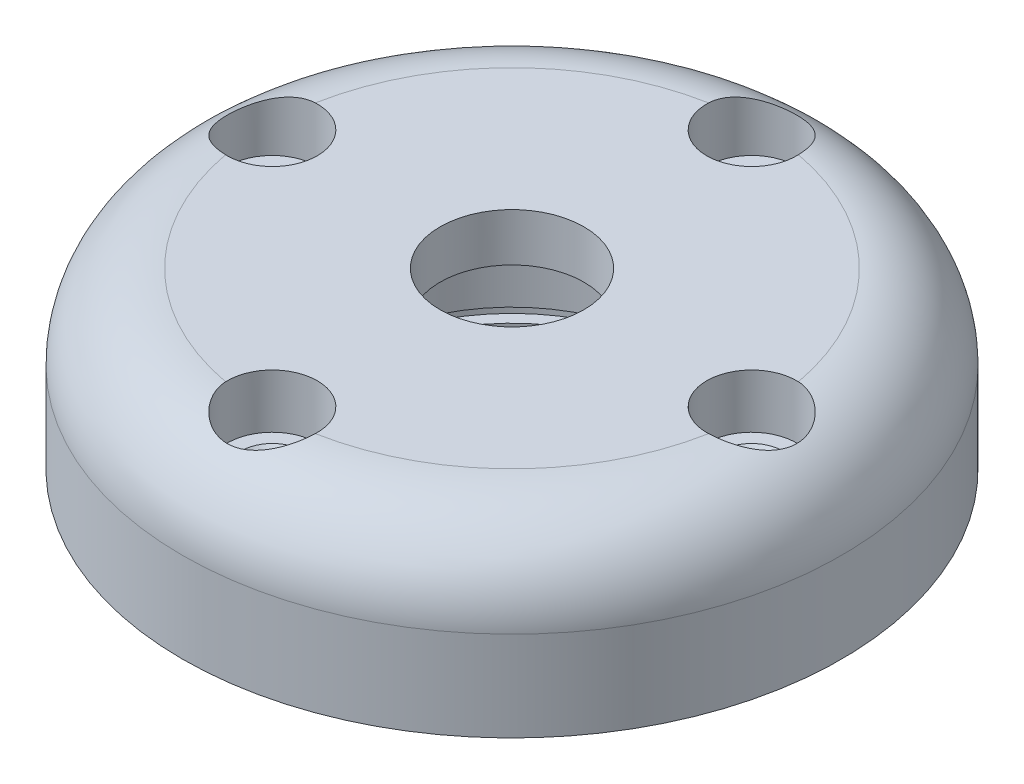
from build123d import *

# Parameters (mm, degrees)
BOSS_EXTRUDE1_START       = 3
SKETCH1_R                 = 27.5
SKETCH1_R_2               = 14
BOSS_EXTRUDE1_DEPTH       = 18
BOSS_EXTRUDE2_START       = 18
SKETCH1_3_R               = 14
BOSS_EXTRUDE2_DEPTH       = 3
BOSS_EXTRUDE3_START       = 9
SKETCH1_4_R               = 14
SKETCH1_4_R_2             = 13
BOSS_EXTRUDE3_DEPTH       = 9
CUT_EXTRUDE1_REACH        = 44.854
SKETCH2_R                 = 2.1
SKETCH2_3_R               = 3.75
SKETCH2_3_R_2             = 2.1
CUT_EXTRUDE2_DEPTH        = 4.5
CHAMFER1_SIZE             = 0.5
BOSS_EXTRUDE4_START       = 3
BOSS_EXTRUDE4_OUTLINE_R   = 14
BOSS_EXTRUDE4_OUTLINE_R_2 = 13
BOSS_EXTRUDE4_DEPTH       = 4.84
BOSS_EXTRUDE5_START       = 1
SKETCH3_R                 = 13
BOSS_EXTRUDE5_DEPTH       = 1
SKETCH4_R                 = 35
CUT_EXTRUDE3_DEPTH        = 3.5
CUT_EXTRUDE5_REACH        = 42.283
SKETCH5_R                 = 6
FILLET1_R                 = 7


# Read off the part's stored shape, not the designer's step: Boss-Extrude4
with BuildPart() as part:
    # Sketch1 → Boss-Extrude1 (new body)
    with BuildSketch(Plane(origin=(0, 0, 0), x_dir=(1, 0, 0), z_dir=(0, 1, 0)).offset(BOSS_EXTRUDE1_START)):
        with Locations(Location((0, 0, 0), (0, 0, 270))):
            Circle(SKETCH1_R)
        with Locations(Location((0, 0, 0), (0, 0, 270))):
            Circle(SKETCH1_R_2, mode=Mode.SUBTRACT)
    extrude(amount=BOSS_EXTRUDE1_DEPTH)

    # Sketch1<3> → Boss-Extrude2 (add)
    with BuildSketch(Plane(origin=(0, 0, 0), x_dir=(1, 0, 0), z_dir=(0, 1, 0)).offset(BOSS_EXTRUDE2_START)):
        with Locations(Location((0, 0, 0), (0, 0, 270))):
            Circle(SKETCH1_3_R)
    extrude(amount=BOSS_EXTRUDE2_DEPTH)

    # Sketch1<4> → Boss-Extrude3 (add)
    with BuildSketch(Plane(origin=(0, 0, 0), x_dir=(1, 0, 0), z_dir=(0, 1, 0)).offset(BOSS_EXTRUDE3_START)):
        with Locations(Location((0, 0, 0), (0, 0, 270))):
            Circle(SKETCH1_4_R)
        with Locations(Location((0, 0, 0), (0, 0, 270))):
            Circle(SKETCH1_4_R_2, mode=Mode.SUBTRACT)
    extrude(amount=BOSS_EXTRUDE3_DEPTH)

    # Sketch2 → Cut-Extrude1 (cut, up to next)
    with BuildSketch(Plane(origin=(0, 21, 0), x_dir=(1, 0, 0), z_dir=(0, 1, 0)), mode=Mode.PRIVATE) as cut_extrude1_sk1:
        with Locations(Location((0, -20, 0), (0, 0, 270))):
            Circle(SKETCH2_R)
    cut_extrude1_tool1 = extrude(cut_extrude1_sk1.sketch, amount=-CUT_EXTRUDE1_REACH, mode=Mode.PRIVATE) & part.part
    # Sketch2 → Cut-Extrude1 (cut, up to next)
    with BuildSketch(Plane(origin=(0, 21, 0), x_dir=(1, 0, 0), z_dir=(0, 1, 0)), mode=Mode.PRIVATE) as cut_extrude1_sk2:
        with Locations(Location((-20, 0, 0), (0, 0, 270))):
            Circle(SKETCH2_R)
    cut_extrude1_tool2 = extrude(cut_extrude1_sk2.sketch, amount=-CUT_EXTRUDE1_REACH, mode=Mode.PRIVATE) & part.part
    # Sketch2 → Cut-Extrude1 (cut, up to next)
    with BuildSketch(Plane(origin=(0, 21, 0), x_dir=(1, 0, 0), z_dir=(0, 1, 0)), mode=Mode.PRIVATE) as cut_extrude1_sk3:
        with Locations(Location((20, 0, 0), (0, 0, 270))):
            Circle(SKETCH2_R)
    cut_extrude1_tool3 = extrude(cut_extrude1_sk3.sketch, amount=-CUT_EXTRUDE1_REACH, mode=Mode.PRIVATE) & part.part
    # Sketch2 → Cut-Extrude1 (cut, up to next)
    with BuildSketch(Plane(origin=(0, 21, 0), x_dir=(1, 0, 0), z_dir=(0, 1, 0)), mode=Mode.PRIVATE) as cut_extrude1_sk4:
        with Locations(Location((0, 20, 0), (0, 0, 270))):
            Circle(SKETCH2_R)
    cut_extrude1_tool4 = extrude(cut_extrude1_sk4.sketch, amount=-CUT_EXTRUDE1_REACH, mode=Mode.PRIVATE) & part.part
    add(cut_extrude1_tool1.solids().sort_by_distance((0, 21, 20))[0], mode=Mode.SUBTRACT)
    add(cut_extrude1_tool2.solids().sort_by_distance((-20, 21, 0))[0], mode=Mode.SUBTRACT)
    add(cut_extrude1_tool3.solids().sort_by_distance((20, 21, 0))[0], mode=Mode.SUBTRACT)
    add(cut_extrude1_tool4.solids().sort_by_distance((0, 21, -20))[0], mode=Mode.SUBTRACT)

    # Sketch2<3> → Cut-Extrude2 (cut)
    # profile 1 of 4: a face of its own
    with BuildSketch(Plane(origin=(0, 21, 0), x_dir=(1, 0, 0), z_dir=(0, 1, 0))):
        with Locations(Location((0, -20, 0), (0, 0, 270))):
            Circle(SKETCH2_3_R)
        with Locations(Location((0, -20, 0), (0, 0, 270))):
            Circle(SKETCH2_3_R_2, mode=Mode.SUBTRACT)
    # profile 2 of 4: a face of its own
    with BuildSketch(Plane(origin=(0, 21, 0), x_dir=(1, 0, 0), z_dir=(0, 1, 0))):
        with Locations(Location((-20, 0, 0), (0, 0, 270))):
            Circle(SKETCH2_3_R)
        with Locations(Location((-20, 0, 0), (0, 0, 270))):
            Circle(SKETCH2_3_R_2, mode=Mode.SUBTRACT)
    # profile 3 of 4: a face of its own
    with BuildSketch(Plane(origin=(0, 21, 0), x_dir=(1, 0, 0), z_dir=(0, 1, 0))):
        with Locations(Location((0, 20, 0), (0, 0, 270))):
            Circle(SKETCH2_3_R)
        with Locations(Location((0, 20, 0), (0, 0, 270))):
            Circle(SKETCH2_3_R_2, mode=Mode.SUBTRACT)
    # profile 4 of 4: a face of its own
    with BuildSketch(Plane(origin=(0, 21, 0), x_dir=(1, 0, 0), z_dir=(0, 1, 0))):
        with Locations(Location((20, 0, 0), (0, 0, 270))):
            Circle(SKETCH2_3_R)
        with Locations(Location((20, 0, 0), (0, 0, 270))):
            Circle(SKETCH2_3_R_2, mode=Mode.SUBTRACT)
    extrude(amount=-CUT_EXTRUDE2_DEPTH, mode=Mode.SUBTRACT)

    # Chamfer1
    chamfer1_edges = [part.edges().sort_by_distance(p)[0] for p in [
        (0, 16.5, 17.9),
        (-20, 16.5, -2.1),
        (0, 16.5, -22.1),
        (20, 16.5, -2.1),
    ]]
    chamfer(chamfer1_edges, length=CHAMFER1_SIZE)

    # Boss-Extrude4 outline → Boss-Extrude4 (add)
    with BuildSketch(Plane(origin=(0, 0, 0), x_dir=(1, 0, 0), z_dir=(0, 1, 0)).offset(BOSS_EXTRUDE4_START)):
        Circle(BOSS_EXTRUDE4_OUTLINE_R)
        Circle(BOSS_EXTRUDE4_OUTLINE_R_2, mode=Mode.SUBTRACT)
    extrude(amount=BOSS_EXTRUDE4_DEPTH)

    # Sketch3 → Boss-Extrude5 (add)
    with BuildSketch(Plane.XZ.offset(-18).offset(BOSS_EXTRUDE5_START)):
        with Locations(Location((0, 0, 0), (0, 0, 270))):
            Circle(SKETCH3_R)
    extrude(amount=-BOSS_EXTRUDE5_DEPTH)

    # Sketch4 → Cut-Extrude3 (cut)
    with BuildSketch(Plane.XZ.offset(-3)):
        Circle(SKETCH4_R)
    extrude(amount=-CUT_EXTRUDE3_DEPTH, mode=Mode.SUBTRACT)

    # Sketch5 → Cut-Extrude5 (cut, up to next)
    with BuildSketch(Plane.XZ.offset(-17), mode=Mode.PRIVATE) as cut_extrude5_sk1:
        with Locations(Location((0, 0, 0), (0, 0, 270))):
            Circle(SKETCH5_R)
    cut_extrude5_tool1 = extrude(cut_extrude5_sk1.sketch, amount=-CUT_EXTRUDE5_REACH, mode=Mode.PRIVATE) & part.part
    add(cut_extrude5_tool1.solids().sort_by_distance((0, 17, 0))[0], mode=Mode.SUBTRACT)

    # Fillet1
    # the kernel refuses this fillet: 7 mm, written as the material it takes off along each edge
    with BuildSketch(Plane(origin=(0, 21, 0), x_dir=(0, 0, 1), z_dir=(-1, 0, 0))) as fillet1_piece_1:
        with BuildLine():
            CenterArc((27.5 - FILLET1_R, -FILLET1_R), FILLET1_R, 0, 90)
            Line((27.5 - FILLET1_R, 0), (27.5, 0))
            Line((27.5, 0), (27.5, -FILLET1_R))
        make_face()
    revolve(axis=Axis((0, 21, 0), (0, 1, 0)), mode=Mode.SUBTRACT)


solid = part.part
